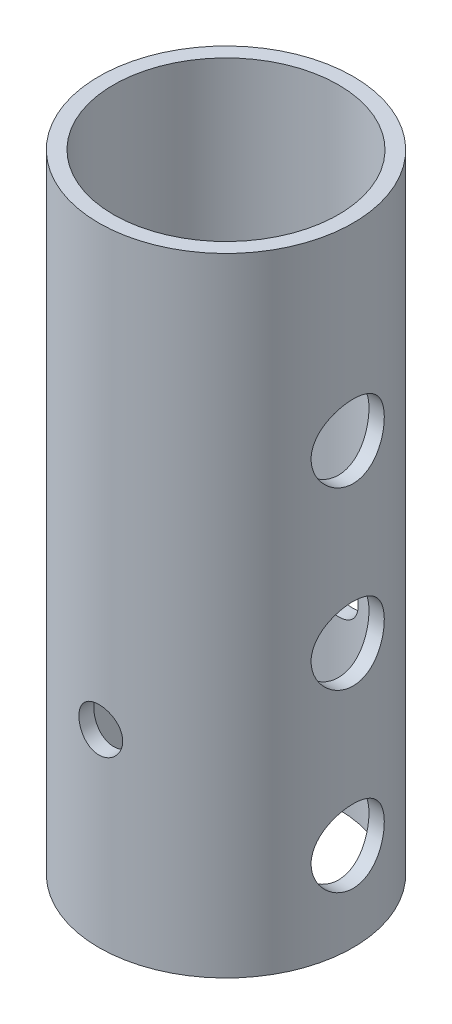
from build123d import *

# Parameters (mm, degrees)
SKETCH1_R               = 43.5
SKETCH1_R_2             = 38.5
BOSS_EXTRUDE1_DEPTH     = 214.8
SKETCH2_R               = 12.53
CUT_EXTRUDE1_DEPTH      = 224.435762581
CUT_EXTRUDE2_DEPTH      = 224.435762716
CUT_EXTRUDE2_DEPTH_BACK = 224.435762716
SKETCH4_R               = 7.5


with BuildPart() as part:
    # Sketch1 → Boss-Extrude1 (new body)
    with BuildSketch(Plane(origin=(0, 0, 0), x_dir=(1, 0, 0), z_dir=(0, 1, 0))):
        Circle(SKETCH1_R)
        Circle(SKETCH1_R_2, mode=Mode.SUBTRACT)
    extrude(amount=BOSS_EXTRUDE1_DEPTH)

    # Sketch2 → Cut-Extrude1 (cut, through all)
    with BuildSketch(Plane(origin=(0, 0, 0), x_dir=(0, 0, -1), z_dir=(1, 0, 0))):
        with Locations((0, 150.1)):
            Circle(SKETCH2_R)
        with Locations((0, 90.1)):
            Circle(SKETCH2_R)
        with Locations((0, 30.1)):
            Circle(SKETCH2_R)
    extrude(amount=CUT_EXTRUDE1_DEPTH, mode=Mode.SUBTRACT)

    # Sketch4 → Cut-Extrude2 (cut, two sides: drawn at the far end of the back side and taken through both)
    with BuildSketch(Plane.XY.offset(-CUT_EXTRUDE2_DEPTH_BACK)):
        with Locations((0, 64.6)):
            Circle(SKETCH4_R)
    extrude(amount=CUT_EXTRUDE2_DEPTH + CUT_EXTRUDE2_DEPTH_BACK, mode=Mode.SUBTRACT)


solid = part.part
